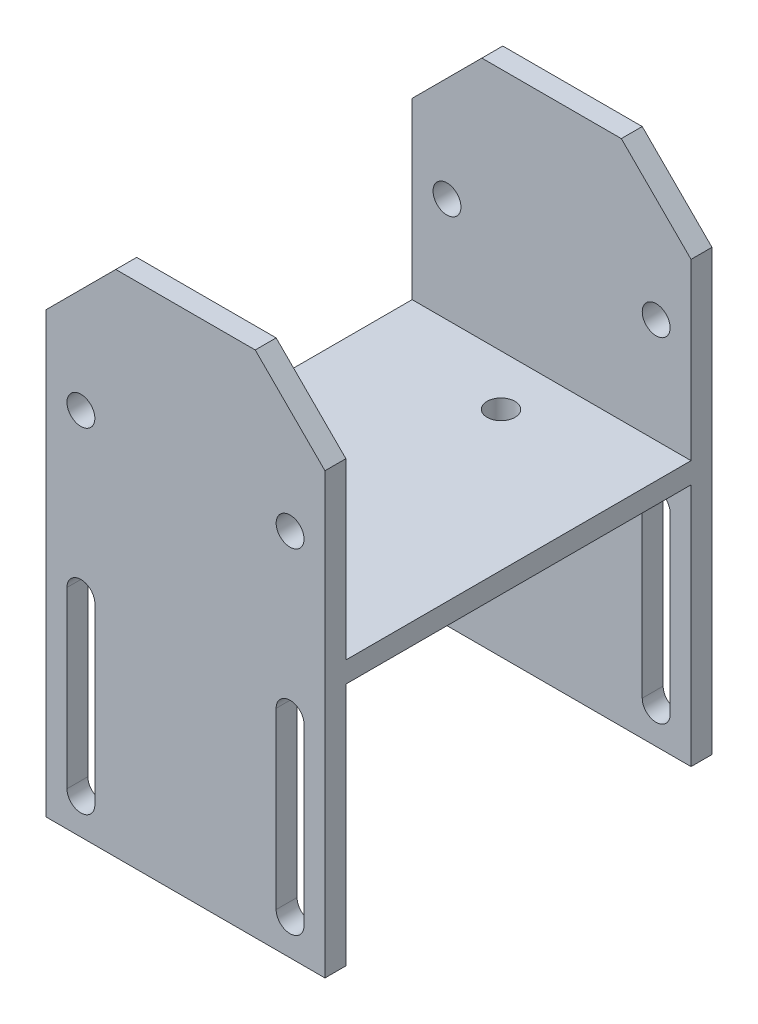
from build123d import *

# Parameters (mm, degrees)
SALIENTE_EXTRUIR1_DEPTH = 40
CROQUIS3_R              = 2
CORTAR_EXTRUIR1_DEPTH   = 79
CHAFL_N1_SIZE           = 10
CROQUIS6_R              = 2
CORTAR_EXTRUIR2_DEPTH   = 9


with BuildPart() as part:
    # Croquis1 → Saliente-Extruir1 (new body)
    with BuildSketch(Plane(origin=(0, 0, 0), x_dir=(0, 0, -1), z_dir=(1, 0, 0))):
        Polygon((0, 0), (0, 73), (3, 73), (3, 38), (52.5, 38), (52.5, 73), (55.5, 73), (55.5, 0), (52.5, 0), (52.5, 35), (3, 35), (3, 0), align=None)
    extrude(amount=SALIENTE_EXTRUIR1_DEPTH)

    # Croquis3 → Cortar-Extruir1 (cut)
    with BuildSketch(Plane.XY):
        with Locations((5, 53)):
            Circle(CROQUIS3_R)
        with Locations((35, 53)):
            Circle(CROQUIS3_R)
        with BuildLine():
            Line((3, 30), (3, 5))
            ThreePointArc((3, 5), (5, 3), (7, 5))
            Line((7, 5), (7, 30))
            ThreePointArc((7, 30), (5, 32), (3, 30))
        make_face()
        with BuildLine():
            Line((33, 30), (33, 5))
            ThreePointArc((33, 5), (35, 3), (37, 5))
            Line((37, 5), (37, 30))
            ThreePointArc((37, 30), (35, 32), (33, 30))
        make_face()
    extrude(amount=-CORTAR_EXTRUIR1_DEPTH, mode=Mode.SUBTRACT)

    # Chaflán1
    chafl_n1_edges = [part.edges().sort_by_distance(p)[0] for p in [
        (40, 73, -1.5),
        (40, 73, -54),
        (0, 73, -54),
        (0, 73, -1.5),
    ]]
    chamfer(chafl_n1_edges, length=CHAFL_N1_SIZE)

    # Croquis6 → Cortar-Extruir2 (cut)
    with BuildSketch(Plane(origin=(0, 38, 0), x_dir=(1, 0, 0), z_dir=(0, 1, 0))):
        with Locations((20, 45.25)):
            Circle(CROQUIS6_R)
        with Locations((20, 10.25)):
            Circle(CROQUIS6_R)
    extrude(amount=-CORTAR_EXTRUIR2_DEPTH, mode=Mode.SUBTRACT)


solid = part.part
